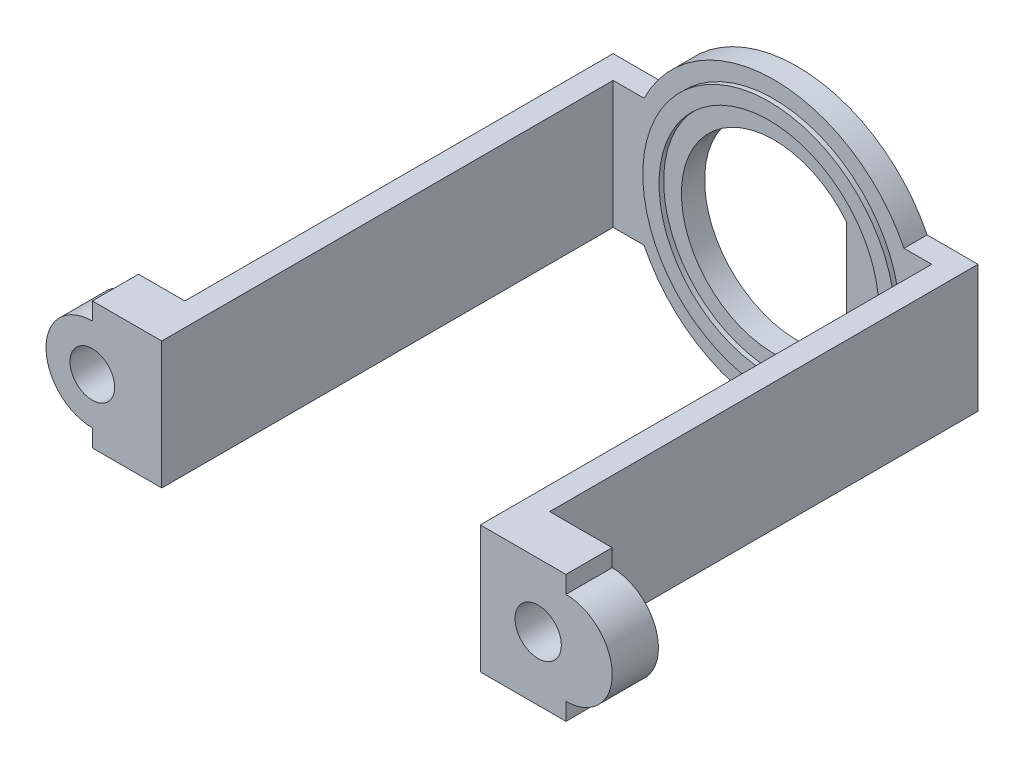
from build123d import *

# Parameters (mm, degrees)
SKETCH1_W               = 20.0152
SKETCH1_H               = 6.985
EXTRUDE1_DEPTH          = 1.27
SKETCH2_R               = 7.9375
EXTRUDE2_DEPTH          = 1.27
CUT_EXTRUDE1_DEPTH      = 2.54
SKETCH4_W               = 1.27
SKETCH4_H               = 6.985
EXTRUDE4_DEPTH          = 24.765
SKETCH5_W               = 2.535412075
SKETCH5_H               = 6.985
EXTRUDE5_DEPTH          = 5.08
SKETCH6_W               = 2.53541451
SKETCH6_H               = 6.985
EXTRUDE6_DEPTH          = 5.969
CUT_EXTRUDE4_DEPTH      = 39.518109697
CUT_EXTRUDE4_DEPTH_BACK = 39.518109697
SKETCH8_R               = 1.224845458
CUT_EXTRUDE5_DEPTH      = 5.969
CUT_EXTRUDE6_DEPTH      = 39.518109697
CUT_EXTRUDE6_DEPTH_BACK = 39.518109697
SKETCH10_R              = 1.27
CUT_EXTRUDE7_DEPTH      = 5.969
SKETCH11_R              = 6.9215
SKETCH11_R_2            = 6.0325
EXTRUDE7_DEPTH          = 0.254


with BuildPart() as part:
    # Sketch1 → Extrude1 (new body)
    with BuildSketch(Plane.XY):
        with Locations((10.0076, -3.4925)):
            Rectangle(SKETCH1_W, SKETCH1_H)
    extrude(amount=EXTRUDE1_DEPTH)

    # Sketch2 → Extrude2 (add)
    with BuildSketch(Plane(origin=(0, 0, 0), x_dir=(-1, 0, 0), z_dir=(0, 0, -1))):
        with Locations((-10.0965, -3.4925)):
            Circle(SKETCH2_R)
    extrude(amount=-EXTRUDE2_DEPTH)

    # Sketch3 → Cut-Extrude1 (cut)
    with BuildSketch(Plane(origin=(0, 0, 0), x_dir=(-1, 0, 0), z_dir=(0, 0, -1))):
        with BuildLine():
            Line((-14.062073729, -0.3175), (-14.062073729, -6.6675))
            ThreePointArc((-14.062073729, -6.6675), (-5.0165, -3.4925), (-14.062073729, -0.3175))
        make_face()
    extrude(amount=-CUT_EXTRUDE1_DEPTH, mode=Mode.SUBTRACT)

    # Sketch4 → Extrude4 (add)
    with BuildSketch(Plane.XY.offset(1.27)):
        with Locations((0.635, -3.4925)):
            Rectangle(SKETCH4_W, SKETCH4_H)
        with Locations((19.3802, -3.4925)):
            Rectangle(SKETCH4_W, SKETCH4_H)
    extrude(amount=EXTRUDE4_DEPTH)

    # Sketch5 → Extrude5 (add)
    with BuildSketch(Plane.ZY):
        with Locations((24.767293962, -3.4925)):
            Rectangle(SKETCH5_W, SKETCH5_H)
    extrude(amount=EXTRUDE5_DEPTH)

    # Sketch6 → Extrude6 (add)
    with BuildSketch(Plane(origin=(20.0152, 0, 0), x_dir=(0, 0, -1), z_dir=(1, 0, 0))):
        with Locations((-24.767292745, -3.4925)):
            Rectangle(SKETCH6_W, SKETCH6_H)
    extrude(amount=EXTRUDE6_DEPTH)

    # Sketch7 → Cut-Extrude4 (cut, two sides: drawn at the far end of the back side and taken through both)
    with BuildSketch(Plane.XY.offset(26.035).offset(-CUT_EXTRUDE4_DEPTH_BACK)):
        with BuildLine():
            Line((-2.54, -78.443112097), (-2.54, -6.985))
            Line((-2.54, -6.985), (-2.54, -6.0325))
            ThreePointArc((-2.54, -6.0325), (-5.08, -3.4925), (-2.54, -0.9525))
            Line((-2.54, -0.9525), (-2.54, 0))
            Line((-2.54, 0), (-2.54, 71.458112097))
            Line((-2.54, 71.458112097), (-145.456224195, 71.458112097))
            Line((-145.456224195, 71.458112097), (-145.456224195, -78.443112097))
            Line((-145.456224195, -78.443112097), (-2.54, -78.443112097))
        make_face()
    extrude(amount=CUT_EXTRUDE4_DEPTH + CUT_EXTRUDE4_DEPTH_BACK, mode=Mode.SUBTRACT)

    # Sketch8 → Cut-Extrude5 (cut)
    with BuildSketch(Plane.XY.offset(26.035)):
        with Locations((-2.54, -3.4925)):
            Circle(SKETCH8_R)
    extrude(amount=-CUT_EXTRUDE5_DEPTH, mode=Mode.SUBTRACT)

    # Sketch9 → Cut-Extrude6 (cut, two sides: drawn at the far end of the back side and taken through both)
    with BuildSketch(Plane.XY.offset(26.035).offset(-CUT_EXTRUDE6_DEPTH_BACK)):
        with BuildLine():
            Line((23.4442, -78.443112097), (23.4442, -6.985))
            Line((23.4442, -6.985), (23.4442, -6.0325))
            ThreePointArc((23.4442, -6.0325), (25.9842, -3.4925), (23.4442, -0.9525))
            Line((23.4442, -0.9525), (23.4442, 0))
            Line((23.4442, 0), (23.4442, 71.458112097))
            Line((23.4442, 71.458112097), (166.360424195, 71.458112097))
            Line((166.360424195, 71.458112097), (166.360424195, -78.443112097))
            Line((166.360424195, -78.443112097), (23.4442, -78.443112097))
        make_face()
    extrude(amount=CUT_EXTRUDE6_DEPTH + CUT_EXTRUDE6_DEPTH_BACK, mode=Mode.SUBTRACT)

    # Sketch10 → Cut-Extrude7 (cut)
    with BuildSketch(Plane.XY.offset(26.035)):
        with Locations((21.9202, -3.4925)):
            Circle(SKETCH10_R)
    extrude(amount=-CUT_EXTRUDE7_DEPTH, mode=Mode.SUBTRACT)

    # Sketch11 → Extrude7 (add)
    with BuildSketch(Plane.XY.offset(1.27)):
        with Locations((10.072511111, -3.393722222)):
            Circle(SKETCH11_R)
        with Locations((10.072511111, -3.393722222)):
            Circle(SKETCH11_R_2, mode=Mode.SUBTRACT)
    extrude(amount=EXTRUDE7_DEPTH)


solid = part.part
